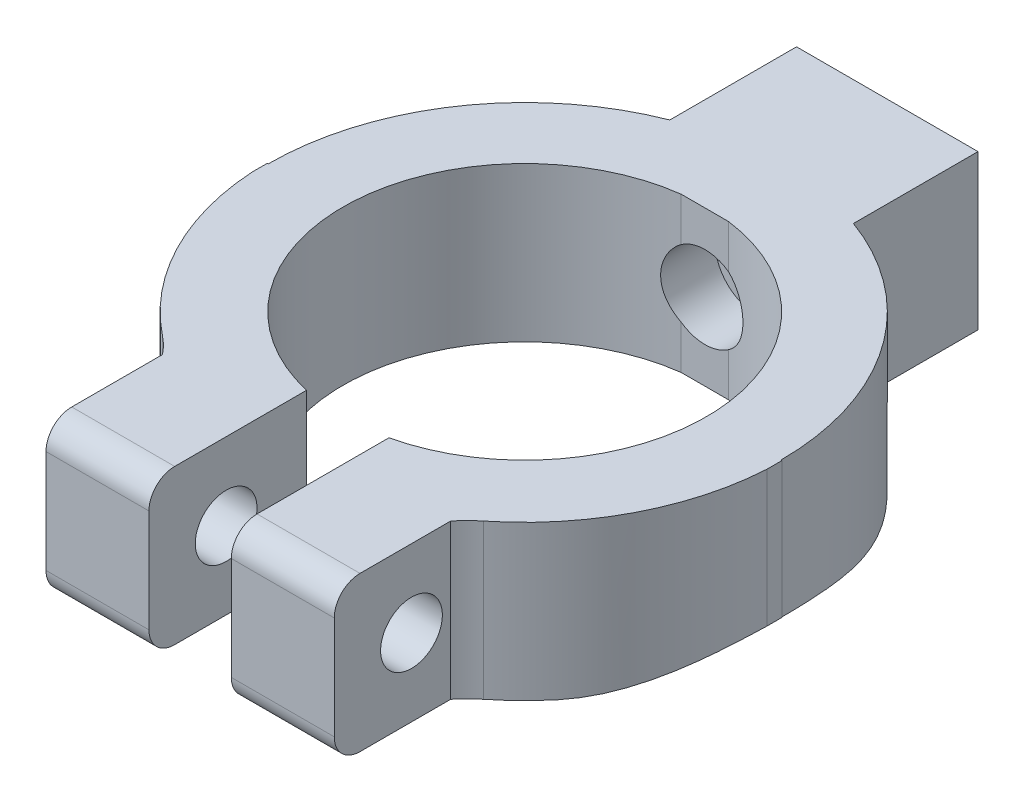
from build123d import *

# Parameters (mm, degrees)
SKETCH1_W                = 55
SKETCH1_H                = 40
BOSS_EXTRUDE1_DEPTH      = 18
SKETCH2_W                = 55
SKETCH2_H                = 15
BOSS_EXTRUDE2_DEPTH      = 50
CUT_EXTRUDE1_START       = -15
CUT_EXTRUDE1_DEPTH       = 15
SKETCH4_W                = 8
SKETCH4_H                = 40.233753348
CUT_EXTRUDE2_DEPTH       = 50
SKETCH6_R                = 3
CUT_EXTRUDE3_DEPTH       = 62
FILLET1_R                = 2.5
CUT_EXTRUDE6_DEPTH       = 67.335088131
CUT_EXTRUDE6_DEPTH_BACK  = 67.335088131
CUT_EXTRUDE7_DEPTH       = 61
CUT_EXTRUDE8_DEPTH       = 39
FILLET2_R                = 20
CUT_EXTRUDE9_DEPTH       = 80.705724129
CUT_EXTRUDE9_DEPTH_BACK  = 80.705724129
FILLET4_DEPTH            = 68
FILLET4_2_DEPTH          = 18
FILLET4_START            = -18
FILLET4_3_DEPTH          = 52
CUT_EXTRUDE12_DEPTH      = 19
SKETCH16_W               = 51.141958407
SKETCH16_H               = 24.204184136
CUT_EXTRUDE13_DEPTH      = 19
CUT_EXTRUDE14_DEPTH      = 78.013318614
CUT_EXTRUDE14_DEPTH_BACK = 19
SKETCH17_R               = 3
FILLET6_R                = 10
SKETCH21_R               = 4
CUT_EXTRUDE16_DEPTH      = 7
CUT_EXTRUDE17_DEPTH      = 19
CUT_EXTRUDE18_DEPTH      = 19
FILLET7_R                = 10


with BuildPart() as part:
    # Sketch1 → Boss-Extrude1 (new body)
    with BuildSketch(Plane.XY):
        with Locations((8.018292683, -5.274390244)):
            Rectangle(SKETCH1_W, SKETCH1_H)
    extrude(amount=BOSS_EXTRUDE1_DEPTH)

    # Sketch2 → Boss-Extrude2 (add)
    with BuildSketch(Plane.XY.offset(18)):
        with Locations((8.018292683, 7.225609756)):
            Rectangle(SKETCH2_W, SKETCH2_H)
    extrude(amount=BOSS_EXTRUDE2_DEPTH)

    # Cut-Extrude1: read off the stored shape, not the designer's step
    # Cut-Extrude1 outline → Cut-Extrude1 (cut)
    with BuildSketch(Plane(origin=(0, -0.274390244, 0), x_dir=(-1, 0, 0), z_dir=(0, -1, 0)).offset(CUT_EXTRUDE1_START)):
        with BuildLine():
            ThreePointArc((-10.314485184, -18), (-8.018292683, -53.15), (-5.722100182, -18))
            Line((-5.722100182, -18), (-10.314485184, -18))
        make_face()
    extrude(amount=CUT_EXTRUDE1_DEPTH, mode=Mode.SUBTRACT)

    # Sketch4 → Cut-Extrude2 (cut)
    with BuildSketch(Plane(origin=(0, -0.274390244, 0), x_dir=(-1, 0, 0), z_dir=(0, -1, 0))):
        with Locations((-8.018292683, -53.15)):
            Rectangle(SKETCH4_W, SKETCH4_H)
    extrude(amount=-CUT_EXTRUDE2_DEPTH, mode=Mode.SUBTRACT)

    # Sketch6 → Cut-Extrude3 (cut)
    with BuildSketch(Plane.ZY.offset(19.481707317)):
        with Locations(Location((60.5, 7.225609756, 0), (0, 0, 270))):
            Circle(SKETCH6_R)
    extrude(amount=-CUT_EXTRUDE3_DEPTH, mode=Mode.SUBTRACT)

    # Fillet1
    fillet1_edges = [part.edges().sort_by_distance(p)[0] for p in [
        (35.518292683, -12.774390244, 18),
        (-19.481707317, -12.774390244, 18),
        (-19.481707317, -0.274390244, 43),
        (35.518292683, -0.274390244, 43),
        (-7.731707317, -0.274390244, 68),
        (23.768292683, 14.725609756, 68),
        (8.018292683, -25.274390244, 18),
        (23.768292683, -0.274390244, 68),
        (-7.731707317, 14.725609756, 68),
        (-19.481707317, 14.725609756, 34),
        (35.518292683, 14.725609756, 34),
    ]]
    fillet(fillet1_edges, radius=FILLET1_R)

    # Sketch10 → Cut-Extrude6 (cut, two sides: drawn at the far end of the back side and taken through both)
    with BuildSketch(Plane.XY.offset(18).offset(-CUT_EXTRUDE6_DEPTH_BACK)):
        with BuildLine():
            ThreePointArc((-3.438146554, -22.774390244), (-11.4271438, -17.219826727), (-16.981707317, -9.230829481))
            Line((-16.981707317, -9.230829481), (-16.981707317, -22.774390244))
            Line((-16.981707317, -22.774390244), (-3.438146554, -22.774390244))
        make_face()
        with BuildLine():
            ThreePointArc((-16.981707317, -9.230829481), (-18.849438892, -3.637409944), (-19.481707317, 2.225609756))
            Line((-19.481707317, 2.225609756), (-19.481707317, -25.274390244))
            Line((-19.481707317, -25.274390244), (8.018292683, -25.274390244))
            ThreePointArc((8.018292683, -25.274390244), (2.155272983, -24.642121819), (-3.438146554, -22.774390244))
            Line((-3.438146554, -22.774390244), (-16.981707317, -22.774390244))
            Line((-16.981707317, -22.774390244), (-16.981707317, -9.230829481))
        make_face()
        with BuildLine():
            ThreePointArc((19.47473192, -22.774390244), (13.881312383, -24.642121819), (8.018292683, -25.274390244))
            Line((8.018292683, -25.274390244), (35.518292683, -25.274390244))
            Line((35.518292683, -25.274390244), (35.518292683, 2.225609756))
            ThreePointArc((35.518292683, 2.225609756), (34.886024258, -3.637409944), (33.018292683, -9.230829481))
            Line((33.018292683, -9.230829481), (33.018292683, -22.774390244))
            Line((33.018292683, -22.774390244), (19.47473192, -22.774390244))
        make_face()
        with BuildLine():
            ThreePointArc((33.018292683, -9.230829481), (27.463729166, -17.219826727), (19.47473192, -22.774390244))
            Line((19.47473192, -22.774390244), (33.018292683, -22.774390244))
            Line((33.018292683, -22.774390244), (33.018292683, -9.230829481))
        make_face()
    extrude(amount=CUT_EXTRUDE6_DEPTH + CUT_EXTRUDE6_DEPTH_BACK, mode=Mode.SUBTRACT)

    # Sketch11 → Cut-Extrude7 (cut)
    with BuildSketch(Plane(origin=(0, 14.725609756, 0), x_dir=(1, 0, 0), z_dir=(0, 1, 0))):
        Polygon((-16.981707317, -68), (-16.981707317, 0), (-29.965472326, 0), (-29.965472326, -73.975211298), (-16.981707317, -73.975211298), align=None)
    extrude(amount=-CUT_EXTRUDE7_DEPTH, mode=Mode.SUBTRACT)

    # Sketch12 → Cut-Extrude8 (cut)
    with BuildSketch(Plane(origin=(0, 14.725609756, 0), x_dir=(1, 0, 0), z_dir=(0, 1, 0))):
        Polygon((33.018292683, -34), (33.018292683, -69.603278632), (51.263623859, -69.603278632), (51.263623859, -68), (51.263623859, 5.657942166), (48.966322657, 5.657942166), (33.018292683, 5.657942166), align=None)
    extrude(amount=-CUT_EXTRUDE8_DEPTH, mode=Mode.SUBTRACT)

    # Fillet2
    fillet2_edges = [part.edges().sort_by_distance(p)[0] for p in [
        (-16.981707317, -9.230829481, 9),
        (33.018292683, -9.230829481, 9),
    ]]
    fillet(fillet2_edges, radius=FILLET2_R)

    # Sketch13 → Cut-Extrude9 (cut, two sides: drawn at the far end of the back side and taken through both)
    with BuildSketch(Plane(origin=(0, 0, 0), x_dir=(-1, 0, 0), z_dir=(0, 0, -1)).offset(-CUT_EXTRUDE9_DEPTH_BACK)):
        with BuildLine():
            Line((15.409844247, 2.637038383), (21.378631307, -1.925347001))
            Line((21.378631307, -1.925347001), (18.152736662, -25.695120221))
            Line((18.152736662, -25.695120221), (-4.693551269, -34.090790667))
            Line((-4.693551269, -34.090790667), (-38.816552793, -29.459816409))
            Line((-38.816552793, -29.459816409), (-43.750527307, -6.539564186))
            Line((-43.750527307, -6.539564186), (-31.534000974, 2.637038383))
            ThreePointArc((-31.534000974, 2.637038383), (-29.812131381, -4.006457809), (-26.853089861, -10.198787729))
            ThreePointArc((-26.853089861, -10.198787729), (-8.062078363, -22.773516814), (10.728933135, -10.198787729))
            ThreePointArc((10.728933135, -10.198787729), (13.687974655, -4.006457809), (15.409844247, 2.637038383))
        make_face()
    extrude(amount=CUT_EXTRUDE9_DEPTH + CUT_EXTRUDE9_DEPTH_BACK, mode=Mode.SUBTRACT)

    # Fillet4: read off the stored shape, not the designer's step
    # Fillet4 outline → Fillet4 (add)
    with BuildSketch(Plane.XY):
        with BuildLine():
            ThreePointArc((31.153095191, -0.274390244), (31.967368862, 0.746702465), (33.018292683, 1.52209337))
            Line((33.018292683, 1.52209337), (31.534000974, 2.637038383))
            ThreePointArc((31.534000974, 2.637038383), (31.270593615, 1.175225559), (30.946719887, -0.274390244))
            Line((30.946719887, -0.274390244), (31.153095191, -0.274390244))
        make_face()
        with BuildLine():
            ThreePointArc((-16.981707317, 1.435547188), (-15.921170685, 0.70393524), (-15.08279533, -0.274390244))
            Line((-15.08279533, -0.274390244), (-14.82256316, -0.274390244))
            ThreePointArc((-14.82256316, -0.274390244), (-15.146436888, 1.175225559), (-15.409844247, 2.637038383))
            Line((-15.409844247, 2.637038383), (-16.981707317, 1.435547188))
        make_face()
    extrude(amount=FILLET4_DEPTH)

    # Fillet4 2 outline → Fillet4 2 (add)
    with BuildSketch(Plane.XY):
        with BuildLine():
            ThreePointArc((30.624925491, -1.492895434), (30.848374458, -0.866028928), (31.153095191, -0.274390244))
            Line((31.153095191, -0.274390244), (30.946719887, -0.274390244))
            ThreePointArc((30.946719887, -0.274390244), (30.791189941, -0.885060274), (30.624925491, -1.492895434))
        make_face()
        with BuildLine():
            ThreePointArc((-15.08279533, -0.274390244), (-14.721255817, -0.92925432), (-14.461460233, -1.63072708))
            ThreePointArc((-14.461460233, -1.63072708), (-14.648665519, -0.954330135), (-14.82256316, -0.274390244))
            Line((-14.82256316, -0.274390244), (-15.08279533, -0.274390244))
        make_face()
    extrude(amount=FILLET4_2_DEPTH)

    # Fillet4 3 outline → Fillet4 3 (cut)
    with BuildSketch(Plane.YZ.offset(FILLET4_START)):
        with BuildLine():
            Line((-0.274390244, 68), (-0.274390244, 65.5))
            ThreePointArc((-0.274390244, 65.5), (0.457842803, 67.267766953), (2.225609756, 68))
            Line((2.225609756, 68), (-0.274390244, 68))
        make_face()
    extrude(amount=FILLET4_3_DEPTH, mode=Mode.SUBTRACT)

    # Sketch15 → Cut-Extrude12 (cut)
    with BuildSketch(Plane(origin=(0, 14.725609756, 0), x_dir=(1, 0, 0), z_dir=(0, 1, 0))):
        with BuildLine():
            Line((-17.024514656, -35.5), (-33.27975261, -35.5))
            Line((-33.27975261, -35.5), (-35.19687657, -60.540801199))
            Line((-35.19687657, -60.540801199), (-35.19687657, -93.839402474))
            Line((-35.19687657, -93.839402474), (-5.981707317, -96.076116088))
            Line((-5.981707317, -96.076116088), (-5.981707317, -56.688765002))
            Line((-5.981707317, -56.688765002), (-5.330056918, -56.688765002))
            ThreePointArc((-5.330056918, -56.688765002), (-13.906833847, -47.600868813), (-17.024514656, -35.5))
        make_face()
        with BuildLine():
            Line((22.018292683, -56.688765002), (22.018292683, -96.076116088))
            Line((22.018292683, -96.076116088), (51.233461936, -93.839402474))
            Line((51.233461936, -93.839402474), (51.233461936, -60.540801199))
            Line((51.233461936, -60.540801199), (49.316337976, -35.5))
            Line((49.316337976, -35.5), (33.061100022, -35.5))
            ThreePointArc((33.061100022, -35.5), (29.943419213, -47.600868813), (21.366642284, -56.688765002))
            Line((21.366642284, -56.688765002), (22.018292683, -56.688765002))
        make_face()
    extrude(amount=-CUT_EXTRUDE12_DEPTH, mode=Mode.SUBTRACT)

    # Sketch16 → Cut-Extrude13 (cut)
    with BuildSketch(Plane.XY.offset(18)):
        with Locations((10.488183873, -12.376482312)):
            Rectangle(SKETCH16_W, SKETCH16_H)
    extrude(amount=-CUT_EXTRUDE13_DEPTH, mode=Mode.SUBTRACT)

    # Sketch17 → Cut-Extrude14 (cut, two sides: drawn at the far end of the back side and taken through both)
    with BuildSketch(Plane(origin=(0, 0, 0), x_dir=(-1, 0, 0), z_dir=(0, 0, -1)).offset(-CUT_EXTRUDE14_DEPTH_BACK)):
        with Locations(Location((-8.026721307, 7.225609756, 0), (0, 0, 220.307119111))):
            Circle(SKETCH17_R)
    extrude(amount=CUT_EXTRUDE14_DEPTH + CUT_EXTRUDE14_DEPTH_BACK, mode=Mode.SUBTRACT)

    # Fillet6
    # the kernel refuses this fillet: 10 mm, written as the material it adds along each edge
    with BuildSketch(Plane(origin=(21.366642284, 14.725609756, 56.688765002), x_dir=(0.8155038635718538, 0, -0.5787516293708203), z_dir=(0, -1, 0))) as fillet6_piece_1:
        with BuildLine():
            CenterArc((3.30482204, 9.984862506), FILLET6_R, 253.898496667, 12.94853639)
            Line((0.531423418, 0.37714373), (0, 0))
            ThreePointArc((0, 0), (1.377401598, 0.037908534), (2.754803195, 0))
        make_face()
    extrude(amount=15)
    with BuildSketch(Plane(origin=(-5.330056918, 14.725609756, 56.688765002), x_dir=(-0.8155038635718542, 0, -0.5787516293708195), z_dir=(0, -1, 0))) as fillet6_piece_2:
        with BuildLine():
            CenterArc((3.30482204, -9.984862506), FILLET6_R, 93.152966943, 12.94853639)
            Line((0.531423418, -0.37714373), (0, 0))
            ThreePointArc((0, 0), (1.377401598, -0.037908534), (2.754803195, 0))
        make_face()
    extrude(amount=15)

    # Sketch21 → Cut-Extrude16 (cut)
    with BuildSketch(Plane.XY.offset(20)):
        with Locations((8.026721307, 7.225609756)):
            Circle(SKETCH21_R)
    extrude(amount=-CUT_EXTRUDE16_DEPTH, mode=Mode.SUBTRACT)

    # Sketch22 → Cut-Extrude17 (cut)
    with BuildSketch(Plane(origin=(0, -0.274390244, 0), x_dir=(-1, 0, 0), z_dir=(0, -1, 0))):
        Polygon((-16.550364213, 0), (1.076683558, 0), (1.076683558, -7), (21.110231161, -7), (21.110231161, 7.483175263), (-36.583911817, 7.483175263), (-36.583911817, -7), (-16.550364213, -7), align=None)
    extrude(amount=-CUT_EXTRUDE17_DEPTH, mode=Mode.SUBTRACT)

    # Sketch23 → Cut-Extrude18 (cut)
    with BuildSketch(Plane.XZ.offset(0.274390244)):
        with BuildLine():
            Line((-1.076683558, 7), (-1.076683558, 12.311685022))
            ThreePointArc((-1.076683558, 12.311685022), (-12.560284622, 21.466515028), (-16.88986952, 35.5))
            Line((-16.88986952, 35.5), (-40.344642409, 35.5))
            Line((-40.344642409, 35.5), (-40.344642409, 5.039728318))
            Line((-40.344642409, 5.039728318), (-1.076683558, 7))
        make_face()
        with BuildLine():
            Line((16.550364213, 7), (16.550364213, 12.09871158))
            ThreePointArc((16.550364213, 12.09871158), (28.425825188, 21.218922962), (32.926454886, 35.5))
            Line((32.926454886, 35.5), (56.524951208, 35.5))
            Line((56.524951208, 35.5), (55.518887179, 6.019864159))
            Line((55.518887179, 6.019864159), (16.550364213, 7))
        make_face()
    extrude(amount=-CUT_EXTRUDE18_DEPTH, mode=Mode.SUBTRACT)

    # Fillet7
    fillet7_edges = [part.edges().sort_by_distance(p)[0] for p in [
        (31.153095191, -0.274390244, 35.678703647),
        (-15.08279533, -0.274390244, 35.677150261),
    ]]
    fillet(fillet7_edges, radius=FILLET7_R)


solid = part.part
